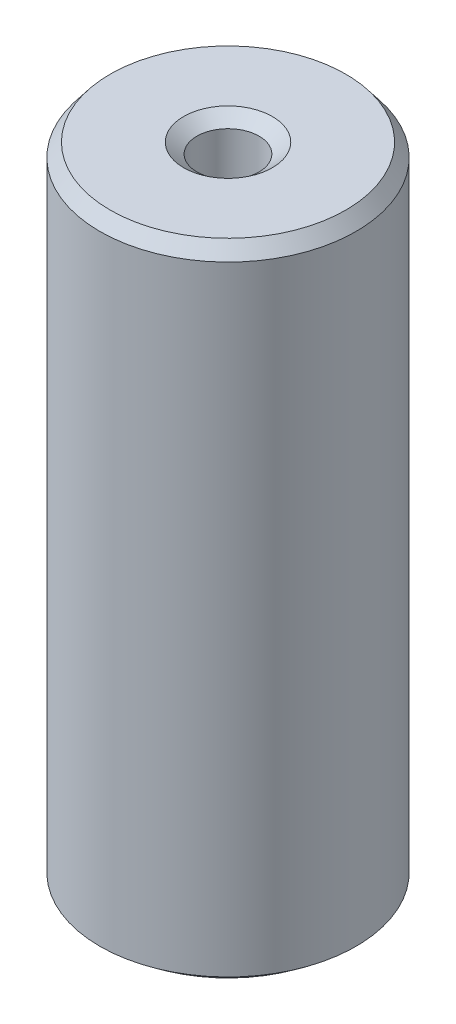
from build123d import *
from OCP.BRepFilletAPI import BRepFilletAPI_MakeChamfer

# Parameters (mm, degrees)
SKETCH1_R           = 5
BOSS_EXTRUDE1_DEPTH = 25.085291829
SKETCH2_R           = 1.211971731
CUT_EXTRUDE1_DEPTH  = 27.062844552
CHAMFER1_SIZE       = 0.520246678
CHAMFER1_SIZE2      = 0.402586488


with BuildPart() as part:
    # Sketch1 → Boss-Extrude1 (new body)
    with BuildSketch(Plane(origin=(0, 0, 0), x_dir=(1, 0, 0), z_dir=(0, 1, 0))):
        Circle(SKETCH1_R)
    extrude(amount=BOSS_EXTRUDE1_DEPTH)

    # Sketch2 → Cut-Extrude1 (cut, through all)
    with BuildSketch(Plane(origin=(0, 0, 0), x_dir=(1, 0, 0), z_dir=(0, 1, 0))):
        Circle(SKETCH2_R)
    extrude(amount=CUT_EXTRUDE1_DEPTH, mode=Mode.SUBTRACT)

    # Chamfer1: one chamfer whose edges measure the first distance from different faces: ONE call of the kernel's chamfer builder (chamfer() names one face for all edges)
    chamfer1_edges_1 = [part.edges().sort_by_distance(p)[0] for p in [
        (-1.211971731, 25.085291829, 0),
    ]]
    chamfer1_side_1 = [part.faces().sort_by_distance(p)[0] for p in [
        (-4.858578644, 25.085291829, 0),
    ]]
    chamfer1_edges_2 = [part.edges().sort_by_distance(p)[0] for p in [
        (-1.211971731, 0, 0),
    ]]
    chamfer1_side_2 = [part.faces().sort_by_distance(p)[0] for p in [
        (-1.211971731, 12.542645914, 0),
    ]]
    chamfer1_edges_3 = [part.edges().sort_by_distance(p)[0] for p in [
        (-5, 0, 0),
    ]]
    chamfer1_side_3 = [part.faces().sort_by_distance(p)[0] for p in [
        (-4.858578644, 0, 0),
    ]]
    chamfer1_edges_4 = [part.edges().sort_by_distance(p)[0] for p in [
        (-5, 25.085291829, 0),
    ]]
    chamfer1_side_4 = [part.faces().sort_by_distance(p)[0] for p in [
        (-5, 12.542645914, 0),
    ]]
    chamfer1 = BRepFilletAPI_MakeChamfer(part.part.solid().wrapped)
    for e in chamfer1_edges_1:
        chamfer1.Add(CHAMFER1_SIZE, CHAMFER1_SIZE2, e.wrapped, chamfer1_side_1[0].wrapped)  # the first distance lies on this face
    for e in chamfer1_edges_2:
        chamfer1.Add(CHAMFER1_SIZE, CHAMFER1_SIZE2, e.wrapped, chamfer1_side_2[0].wrapped)  # the first distance lies on this face
    for e in chamfer1_edges_3:
        chamfer1.Add(CHAMFER1_SIZE, CHAMFER1_SIZE2, e.wrapped, chamfer1_side_3[0].wrapped)  # the first distance lies on this face
    for e in chamfer1_edges_4:
        chamfer1.Add(CHAMFER1_SIZE, CHAMFER1_SIZE2, e.wrapped, chamfer1_side_4[0].wrapped)  # the first distance lies on this face
    add(Compound.cast(chamfer1.Shape()), mode=Mode.REPLACE)


solid = part.part
